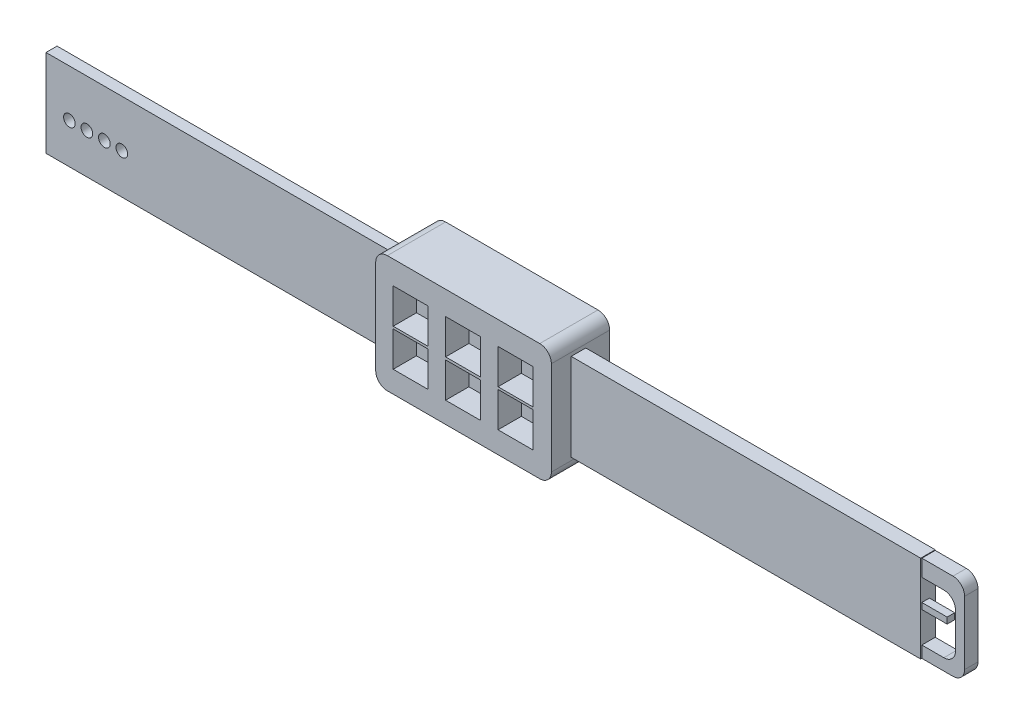
from build123d import *

# Parameters (mm, degrees)
BOSS_EXTRUDE2_DEPTH     = 12.7
SKETCH4_W               = 7.62
SKETCH4_H               = 7.62
CUT_EXTRUDE1_DEPTH      = 5.08
SKETCH5_R               = 1.010710011
SKETCH5_W               = 1.95310334
SKETCH5_H               = 1.953103341
CUT_EXTRUDE2_DEPTH      = 1.27
CUT_EXTRUDE6_DEPTH      = 0.508
CUT_EXTRUDE6_DEPTH_BACK = 0.254
SKETCH6_R               = 0.762
BOSS_EXTRUDE3_START     = -2.159
BOSS_EXTRUDE3_OUTLINE_W = 2.409740232
BOSS_EXTRUDE3_OUTLINE_H = 19.05
BOSS_EXTRUDE3_DEPTH     = 2.159
SKETCH8_W               = 3.175
SKETCH8_H               = 19.05
BOSS_EXTRUDE4_DEPTH     = 76.2
SKETCH9_W               = 25.4
SKETCH9_H               = 17.78
BOSS_EXTRUDE5_DEPTH     = 0.0254
SKETCH7_2_W             = 2.409740232
SKETCH7_2_H             = 19.05
BOSS_EXTRUDE6_DEPTH     = 76.2
CUT_EXTRUDE7_DEPTH      = 38.989
CUT_EXTRUDE7_DEPTH_BACK = 41.529
SKETCH15_R              = 1.27
BOSS_EXTRUDE8_DEPTH     = 2.921
CUT_EXTRUDE8_DEPTH      = 2.921
SKETCH22_W              = 5.599128384
SKETCH22_H              = 1.338572143
BOSS_EXTRUDE9_DEPTH     = 1.651


# Read off the part's stored shape, not the designer's step: Boss-Extrude3
with BuildPart() as part:
    # Sketch3 → Boss-Extrude2 (new body)
    with BuildSketch(Plane.XY):
        with BuildLine():
            Line((-124.751722325, 54.549920467), (-91.529763067, 54.549920467))
            ThreePointArc((-91.529763067, 54.549920467), (-89.733711843, 53.805971692), (-88.989763067, 52.009920467))
            Line((-88.989763067, 52.009920467), (-88.989763067, 31.555280962))
            ThreePointArc((-88.989763067, 31.555280962), (-89.733711843, 29.759229738), (-91.529763067, 29.015280962))
            Line((-91.529763067, 29.015280962), (-124.751722325, 29.015280962))
            ThreePointArc((-124.751722325, 29.015280962), (-126.547773549, 29.759229738), (-127.291722325, 31.555280962))
            Line((-127.291722325, 31.555280962), (-127.291722325, 52.009920467))
            ThreePointArc((-127.291722325, 52.009920467), (-126.547773549, 53.805971692), (-124.751722325, 54.549920467))
        make_face()
    extrude(amount=BOSS_EXTRUDE2_DEPTH)

    # Sketch4 → Cut-Extrude1 (cut)
    with BuildSketch(Plane.XY.offset(12.7)):
        with Locations((-119.671722325, 45.659920467)):
            Rectangle(SKETCH4_W, SKETCH4_H)
        with Locations((-96.811722325, 45.659920467)):
            Rectangle(SKETCH4_W, SKETCH4_H)
        Polygon((-13.53517885, 41.715280962), (0, 47.630459812), (0, 34.095280962), (-13.53517885, 34.095280962), align=None)
        with Locations((-108.241722325, 45.582744839)):
            Rectangle(SKETCH4_W, SKETCH4_H)
        with Locations((-96.811722325, 37.531920467)):
            Rectangle(SKETCH4_W, SKETCH4_H)
        with Locations((-119.671722325, 37.531920467)):
            Rectangle(SKETCH4_W, SKETCH4_H)
        with Locations((-108.241722325, 37.397280962)):
            Rectangle(SKETCH4_W, SKETCH4_H)
    extrude(amount=-CUT_EXTRUDE1_DEPTH, mode=Mode.SUBTRACT)

    # Sketch5 → Cut-Extrude2 (cut)
    with BuildSketch(Plane(origin=(0, 29.015280962, 0), x_dir=(-1, 0, 0), z_dir=(0, -1, 0))):
        with Locations(Location((95.466660312, -4.783448362, 0), (0, 0, 90))):
            Circle(SKETCH5_R)
        with Locations((100.02390144, -4.702069057)):
            Rectangle(SKETCH5_W, SKETCH5_H)
    extrude(amount=-CUT_EXTRUDE2_DEPTH, mode=Mode.SUBTRACT)

    # Sketch6 → Cut-Extrude6 (cut, two sides: drawn at the far end of the back side and taken through both)
    with BuildSketch(Plane.XY.offset(7.62).offset(-CUT_EXTRUDE6_DEPTH_BACK)):
        with Locations((-119.671722325, 45.659920467)):
            Circle(SKETCH6_R)
        with Locations((-108.119080998, 45.582744839)):
            Circle(SKETCH6_R)
        with Locations((-96.719484025, 37.531920467)):
            Circle(SKETCH6_R)
        with Locations((-96.719484025, 45.582744839)):
            Circle(SKETCH6_R)
        with Locations((-119.671722325, 37.531920467)):
            Circle(SKETCH6_R)
        with Locations((-108.119080998, 37.531920467)):
            Circle(SKETCH6_R)
    extrude(amount=CUT_EXTRUDE6_DEPTH + CUT_EXTRUDE6_DEPTH_BACK, mode=Mode.SUBTRACT)

    # Boss-Extrude3 outline → Boss-Extrude3 (cut)
    with BuildSketch(Plane.ZY.offset(127.291722325).offset(BOSS_EXTRUDE3_START)):
        with Locations((7.177129884, 41.849920467)):
            Rectangle(BOSS_EXTRUDE3_OUTLINE_W, BOSS_EXTRUDE3_OUTLINE_H)
    extrude(amount=BOSS_EXTRUDE3_DEPTH, mode=Mode.SUBTRACT)

    # Sketch8 → Boss-Extrude4 (add)
    with BuildSketch(Plane(origin=(-88.989763067, 0, 0), x_dir=(0, 0, -1), z_dir=(1, 0, 0))):
        with Locations((-6.7945, 41.715280962)):
            Rectangle(SKETCH8_W, SKETCH8_H)
    extrude(amount=BOSS_EXTRUDE4_DEPTH)

    # Sketch9 → Boss-Extrude5 (add)
    with BuildSketch(Plane(origin=(0, 0, 0), x_dir=(-1, 0, 0), z_dir=(0, 0, -1))):
        with Locations((108.241722325, 41.849920467)):
            Rectangle(SKETCH9_W, SKETCH9_H)
    extrude(amount=BOSS_EXTRUDE5_DEPTH)

    # Sketch18 → Boss-Extrude8 (add)
    with BuildSketch(Plane(origin=(0, 0, 5.207), x_dir=(-1, 0, 0), z_dir=(0, 0, -1))):
        with BuildLine():
            Line((12.789763067, 32.190280962), (6.009318879, 32.190280962))
            ThreePointArc((6.009318879, 32.190280962), (4.213267655, 32.934229738), (3.469318879, 34.730280962))
            Line((3.469318879, 34.730280962), (3.469318879, 48.572942797))
            ThreePointArc((3.469318879, 48.572942797), (4.213267655, 50.368994021), (6.009318879, 51.112942797))
            Line((6.009318879, 51.112942797), (12.789763067, 51.112942797))
            Line((12.789763067, 51.112942797), (12.789763067, 32.190280962))
        make_face()
    extrude(amount=-BOSS_EXTRUDE8_DEPTH)

    # Sketch19 → Cut-Extrude8 (cut)
    with BuildSketch(Plane.XY.offset(8.128)):
        with BuildLine():
            Line((-7.992540277, 34.714254039), (-12.789763067, 34.714254039))
            Line((-12.789763067, 34.714254039), (-12.789763067, 47.497812307))
            Line((-12.789763067, 47.497812307), (-7.992540277, 47.497812307))
            ThreePointArc((-7.992540277, 47.497812307), (-6.196489053, 46.753863531), (-5.452540277, 44.957812307))
            Line((-5.452540277, 44.957812307), (-5.452540277, 37.254254039))
            ThreePointArc((-5.452540277, 37.254254039), (-6.196489053, 35.458202815), (-7.992540277, 34.714254039))
        make_face()
    extrude(amount=-CUT_EXTRUDE8_DEPTH, mode=Mode.SUBTRACT)

    # Sketch22 → Boss-Extrude9 (add)
    with BuildSketch(Plane.XY.offset(8.128)):
        with Locations((-10.072305381, 42.081115795)):
            Rectangle(SKETCH22_W, SKETCH22_H)
    extrude(amount=-BOSS_EXTRUDE9_DEPTH)


with BuildPart() as body_2:
    # Sketch7<2> → Boss-Extrude6 (new body)
    with BuildSketch(Plane.ZY.offset(127.291722325)):
        with Locations((7.177129884, 41.849920467)):
            Rectangle(SKETCH7_2_W, SKETCH7_2_H)
    extrude(amount=BOSS_EXTRUDE6_DEPTH)

    # Sketch15 → Cut-Extrude7 (cut, two sides: drawn at the far end of the back side and taken through both)
    with BuildSketch(Plane.XY.offset(8.382).offset(-CUT_EXTRUDE7_DEPTH_BACK)):
        with Locations(Location((-198.386411658, 41.089038752, 0), (0, 0, 180))):
            Circle(SKETCH15_R)
        with Locations(Location((-194.576411658, 41.089038752, 0), (0, 0, 180))):
            Circle(SKETCH15_R)
        with Locations(Location((-190.766411658, 41.089038752, 0), (0, 0, 180))):
            Circle(SKETCH15_R)
        with Locations(Location((-186.956411658, 41.089038752, 0), (0, 0, 180))):
            Circle(SKETCH15_R)
    extrude(amount=CUT_EXTRUDE7_DEPTH + CUT_EXTRUDE7_DEPTH_BACK, mode=Mode.SUBTRACT)


solid = Compound([part.part, body_2.part])
